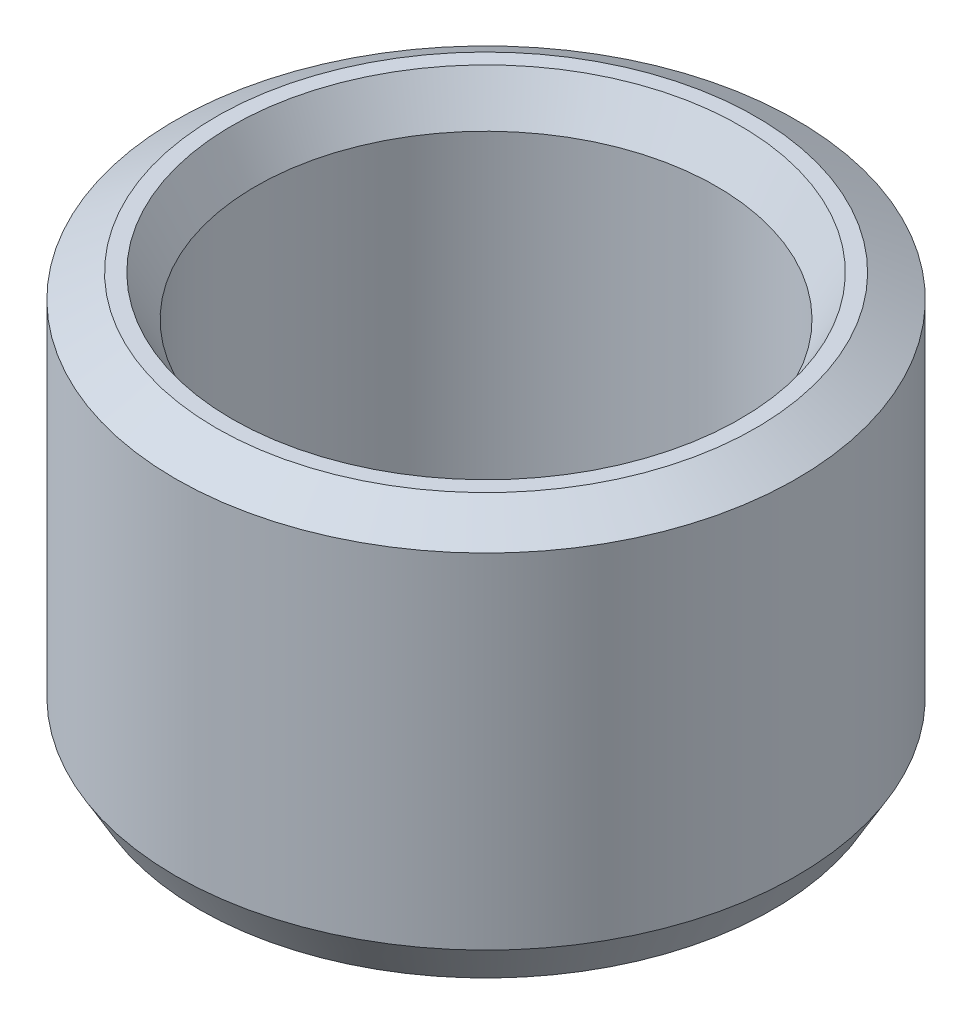
from build123d import *
from OCP.BRepFilletAPI import BRepFilletAPI_MakeChamfer

# Parameters (mm, degrees)
SKETCH1_R           = 27.5
BOSS_EXTRUDE1_DEPTH = 36.143048743
SKETCH2_R           = 20.409142211
CUT_EXTRUDE1_DEPTH  = 54.092560425
CHAMFER1_SIZE       = 2.085024153
CHAMFER1_SIZE2      = 3.611367768


with BuildPart() as part:
    # Sketch1 → Boss-Extrude1 (new body)
    with BuildSketch(Plane(origin=(0, 0, 0), x_dir=(1, 0, 0), z_dir=(0, 1, 0))):
        Circle(SKETCH1_R)
    extrude(amount=BOSS_EXTRUDE1_DEPTH)

    # Sketch2 → Cut-Extrude1 (cut, through all)
    with BuildSketch(Plane(origin=(0, 0, 0), x_dir=(1, 0, 0), z_dir=(0, 1, 0))):
        Circle(SKETCH2_R)
    extrude(amount=CUT_EXTRUDE1_DEPTH, mode=Mode.SUBTRACT)

    # Chamfer1: one chamfer whose edges measure the first distance from different faces: ONE call of the kernel's chamfer builder (chamfer() names one face for all edges)
    chamfer1_edges_1 = [part.edges().sort_by_distance(p)[0] for p in [
        (-20.409142211, 36.143048743, 0),
    ]]
    chamfer1_side_1 = [part.faces().sort_by_distance(p)[0] for p in [
        (-26.722182541, 36.143048743, 0),
    ]]
    chamfer1_edges_2 = [part.edges().sort_by_distance(p)[0] for p in [
        (-20.409142211, 0, 0),
    ]]
    chamfer1_side_2 = [part.faces().sort_by_distance(p)[0] for p in [
        (-20.409142211, 18.071524372, 0),
    ]]
    chamfer1_edges_3 = [part.edges().sort_by_distance(p)[0] for p in [
        (-27.5, 0, 0),
    ]]
    chamfer1_side_3 = [part.faces().sort_by_distance(p)[0] for p in [
        (-26.722182541, 0, 0),
    ]]
    chamfer1_edges_4 = [part.edges().sort_by_distance(p)[0] for p in [
        (-27.5, 36.143048743, 0),
    ]]
    chamfer1_side_4 = [part.faces().sort_by_distance(p)[0] for p in [
        (-27.5, 18.071524372, 0),
    ]]
    chamfer1 = BRepFilletAPI_MakeChamfer(part.part.solid().wrapped)
    for e in chamfer1_edges_1:
        chamfer1.Add(CHAMFER1_SIZE, CHAMFER1_SIZE2, e.wrapped, chamfer1_side_1[0].wrapped)  # the first distance lies on this face
    for e in chamfer1_edges_2:
        chamfer1.Add(CHAMFER1_SIZE, CHAMFER1_SIZE2, e.wrapped, chamfer1_side_2[0].wrapped)  # the first distance lies on this face
    for e in chamfer1_edges_3:
        chamfer1.Add(CHAMFER1_SIZE, CHAMFER1_SIZE2, e.wrapped, chamfer1_side_3[0].wrapped)  # the first distance lies on this face
    for e in chamfer1_edges_4:
        chamfer1.Add(CHAMFER1_SIZE, CHAMFER1_SIZE2, e.wrapped, chamfer1_side_4[0].wrapped)  # the first distance lies on this face
    add(Compound.cast(chamfer1.Shape()), mode=Mode.REPLACE)


solid = part.part
